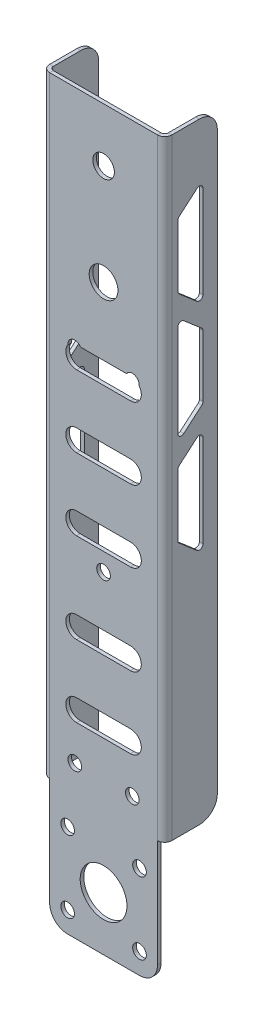
from build123d import *

# Parameters (mm, degrees)
SKETCH1_R                  = 6.5
SKETCH1_R_2                = 3
SKETCH1_R_3                = 4
BASE_FLANGE1_DEPTH         = 1
FILLET1_R                  = 5
SKETCHED_START             = 16.78876
SKETCHED_BEND1_OUTLINE_W   = 170
SKETCHED_BEND1_OUTLINE_H   = 1
SKETCHED_BEND1_DEPTH       = 13.21124
SKETCHED_START_2           = -30
SKETCHED_BEND1_2_OUTLINE_W = 170
SKETCHED_BEND1_2_OUTLINE_H = 1
SKETCHED_BEND1_2_DEPTH     = 13.18876
SKETCHED_START_3           = 16
SKETCHED_BEND1_3_DEPTH     = 0.0274
SKETCHED_START_4           = -16.01124
SKETCHED_BEND1_4_DEPTH     = 0.01124
SKETCHED_START_5           = -17
SKETCHED_BEND1_5_DEPTH     = 2
SKETCHED_START_6           = 15
SKETCHED_BEND1_6_DEPTH     = 2
SKETCHED_START_7           = -40.18
SKETCHED_BEND1_7_DEPTH     = 170
FILLET2_R                  = 1
F_6_CLEARANCE_HOLE2_D      = 3.7973
CUT_EXTRUDE1_DEPTH         = 10


with BuildPart() as part:
    # Base-Flange1: sheet metal written as solids
    # Sketch1 → Base-Flange1 (new body)
    with BuildSketch(Plane.XY):
        Polygon((-30, 129.82), (30, 129.82), (30, -40.18), (15, -40.18), (15, -75.18), (-15, -75.18), (-15, -40.18), (-30, -40.18), align=None)
        with Locations((0, -60.18)):
            Circle(SKETCH1_R, mode=Mode.SUBTRACT)
        with Locations((0, 114.82)):
            Circle(SKETCH1_R_2, mode=Mode.SUBTRACT)
        with Locations((0, 86.82)):
            Circle(SKETCH1_R_3, mode=Mode.SUBTRACT)
        Polygon((-26, 114.82), (-19, 108.82), (-19, 90.82), (-26, 84.82), align=None, mode=Mode.SUBTRACT)
        Polygon((-26, 78.82), (-19, 84.82), (-19, 54.82), (-26, 60.82), align=None, mode=Mode.SUBTRACT)
        Polygon((-26, 24.82), (-26, 54.82), (-19, 48.82), (-19, 30.82), align=None, mode=Mode.SUBTRACT)
        Polygon((19, 30.82), (26, 24.82), (26, 54.82), (19, 48.82), align=None, mode=Mode.SUBTRACT)
        Polygon((19, 54.82), (26, 60.82), (26, 78.82), (19, 84.82), align=None, mode=Mode.SUBTRACT)
        Polygon((19, 90.82), (26, 84.82), (26, 114.82), (19, 108.82), align=None, mode=Mode.SUBTRACT)
    extrude(amount=-BASE_FLANGE1_DEPTH)

    # Fillet1
    fillet1_edges = [part.edges().sort_by_distance(p)[0] for p in [
        (-30, 129.82, -0.5),
        (30, 129.82, -0.5),
        (30, -40.18, -0.5),
        (15, -75.18, -0.5),
        (-15, -75.18, -0.5),
        (-30, -40.18, -0.5),
    ]]
    fillet(fillet1_edges, radius=FILLET1_R)

    # Sketched Bend1: read off the stored shape, not the designer's step
    # Sketched Bend1 outline → Sketched Bend1 (cut)
    with BuildSketch(Plane.YZ.offset(SKETCHED_START)):
        with Locations((44.82, -0.5)):
            Rectangle(SKETCHED_BEND1_OUTLINE_W, SKETCHED_BEND1_OUTLINE_H)
    extrude(amount=SKETCHED_BEND1_DEPTH, mode=Mode.SUBTRACT)

    # Sketched Bend1 2 outline → Sketched Bend1 2 (cut)
    with BuildSketch(Plane.YZ.offset(SKETCHED_START_2)):
        with Locations((44.82, -0.5)):
            Rectangle(SKETCHED_BEND1_2_OUTLINE_W, SKETCHED_BEND1_2_OUTLINE_H)
    extrude(amount=SKETCHED_BEND1_2_DEPTH, mode=Mode.SUBTRACT)

    # Sketched Bend1 3 outline → Sketched Bend1 3 (add)
    with BuildSketch(Plane.YZ.offset(SKETCHED_START_3)):
        with BuildLine():
            Line((129.82, -9.64380551), (129.82, -1))
            Line((129.82, -1), (-40.18, -1))
            Line((-40.18, -1), (-40.18, -9.64380551))
            ThreePointArc((-40.18, -9.64380551), (-38.715533906, -13.179339416), (-35.18, -14.64380551))
            Line((-35.18, -14.64380551), (124.82, -14.64380551))
            ThreePointArc((124.82, -14.64380551), (128.355533906, -13.179339416), (129.82, -9.64380551))
        make_face()
        Polygon((30.82, -3.64380551), (48.82, -3.64380551), (54.82, -10.64380551), (24.82, -10.64380551), align=None, mode=Mode.SUBTRACT)
        Polygon((54.82, -3.64380551), (84.82, -3.64380551), (78.82, -10.64380551), (60.82, -10.64380551), align=None, mode=Mode.SUBTRACT)
        Polygon((90.82, -3.64380551), (108.82, -3.64380551), (114.82, -10.64380551), (84.82, -10.64380551), align=None, mode=Mode.SUBTRACT)
    extrude(amount=SKETCHED_BEND1_3_DEPTH)

    # Sketched Bend1 4 outline → Sketched Bend1 4 (add)
    with BuildSketch(Plane.YZ.offset(SKETCHED_START_4)):
        with BuildLine():
            Line((129.82, -9.64380551), (129.82, -1))
            Line((129.82, -1), (-40.18, -1))
            Line((-40.18, -1), (-40.18, -9.64380551))
            ThreePointArc((-40.18, -9.64380551), (-38.715533906, -13.179339416), (-35.18, -14.64380551))
            Line((-35.18, -14.64380551), (124.82, -14.64380551))
            ThreePointArc((124.82, -14.64380551), (128.355533906, -13.179339416), (129.82, -9.64380551))
        make_face()
        Polygon((30.82, -3.64380551), (48.82, -3.64380551), (54.82, -10.64380551), (24.82, -10.64380551), align=None, mode=Mode.SUBTRACT)
        Polygon((54.82, -3.64380551), (84.82, -3.64380551), (78.82, -10.64380551), (60.82, -10.64380551), align=None, mode=Mode.SUBTRACT)
        Polygon((90.82, -3.64380551), (108.82, -3.64380551), (114.82, -10.64380551), (84.82, -10.64380551), align=None, mode=Mode.SUBTRACT)
    extrude(amount=SKETCHED_BEND1_4_DEPTH)

    # Sketched Bend1 5 outline → Sketched Bend1 5 (add)
    with BuildSketch(Plane.YZ.offset(SKETCHED_START_5)):
        with BuildLine():
            Line((129.82, -9.64380551), (129.82, -1))
            Line((129.82, -1), (-40.18, -1))
            Line((-40.18, -1), (-40.18, -9.64380551))
            ThreePointArc((-40.18, -9.64380551), (-38.715533906, -13.179339416), (-35.18, -14.64380551))
            Line((-35.18, -14.64380551), (124.82, -14.64380551))
            ThreePointArc((124.82, -14.64380551), (128.355533906, -13.179339416), (129.82, -9.64380551))
        make_face()
        Polygon((30.82, -3.64380551), (48.82, -3.64380551), (54.82, -10.64380551), (24.82, -10.64380551), align=None, mode=Mode.SUBTRACT)
        Polygon((54.82, -3.64380551), (84.82, -3.64380551), (78.82, -10.64380551), (60.82, -10.64380551), align=None, mode=Mode.SUBTRACT)
        Polygon((90.82, -3.64380551), (108.82, -3.64380551), (114.82, -10.64380551), (84.82, -10.64380551), align=None, mode=Mode.SUBTRACT)
    extrude(amount=SKETCHED_BEND1_5_DEPTH)

    # Sketched Bend1 6 outline → Sketched Bend1 6 (add)
    with BuildSketch(Plane.YZ.offset(SKETCHED_START_6)):
        with BuildLine():
            Line((129.82, -9.64380551), (129.82, -1))
            Line((129.82, -1), (-40.18, -1))
            Line((-40.18, -1), (-40.18, -9.64380551))
            ThreePointArc((-40.18, -9.64380551), (-38.715533906, -13.179339416), (-35.18, -14.64380551))
            Line((-35.18, -14.64380551), (124.82, -14.64380551))
            ThreePointArc((124.82, -14.64380551), (128.355533906, -13.179339416), (129.82, -9.64380551))
        make_face()
        Polygon((30.82, -3.64380551), (48.82, -3.64380551), (54.82, -10.64380551), (24.82, -10.64380551), align=None, mode=Mode.SUBTRACT)
        Polygon((54.82, -3.64380551), (84.82, -3.64380551), (78.82, -10.64380551), (60.82, -10.64380551), align=None, mode=Mode.SUBTRACT)
        Polygon((90.82, -3.64380551), (108.82, -3.64380551), (114.82, -10.64380551), (84.82, -10.64380551), align=None, mode=Mode.SUBTRACT)
    extrude(amount=SKETCHED_BEND1_6_DEPTH)

    # Sketched Bend1 7 outline → Sketched Bend1 7 (cut)
    with BuildSketch(Plane(origin=(0, 0, 0), x_dir=(1, 0, 0), z_dir=(0, 1, 0)).offset(SKETCHED_START_7)):
        with BuildLine():
            ThreePointArc((-16, 2), (-15.707106781, 1.292893219), (-15, 1))
            Line((-15, 1), (-15, 14.64380551))
            Line((-15, 14.64380551), (-16, 14.64380551))
            Line((-16, 14.64380551), (-16, 2))
        make_face()
        with BuildLine():
            ThreePointArc((17, 2), (16.414213562, 0.585786438), (15, 0))
            Line((15, 0), (16.78876, 0))
            Line((16.78876, 0), (16.78876, 1))
            Line((16.78876, 1), (17, 1))
            Line((17, 1), (17, 2))
        make_face()
        with BuildLine():
            ThreePointArc((-15, 0), (-16.414213562, 0.585786438), (-17, 2))
            Line((-17, 2), (-17, 1))
            Line((-17, 1), (-16.81124, 1))
            Line((-16.81124, 1), (-16.81124, 0))
            Line((-16.81124, 0), (-15, 0))
        make_face()
        with BuildLine():
            ThreePointArc((15, 1), (15.707106781, 1.292893219), (16, 2))
            Line((16, 2), (16, 14.64380551))
            Line((16, 14.64380551), (15, 14.64380551))
            Line((15, 14.64380551), (15, 1))
        make_face()
    extrude(amount=SKETCHED_BEND1_7_DEPTH, mode=Mode.SUBTRACT)

    # Fillet2
    fillet2_edges = [part.edges().sort_by_distance(p)[0] for p in [
        (-16.5, 90.82, -3.64380551),
        (-16.5, 84.82, -10.64380551),
        (-16.5, 114.82, -10.64380551),
        (-16.5, 108.82, -3.64380551),
        (-16.5, 84.82, -3.64380551),
        (-16.5, 54.82, -3.64380551),
        (-16.5, 60.82, -10.64380551),
        (-16.5, 78.82, -10.64380551),
        (-16.5, 24.82, -10.64380551),
        (-16.5, 54.82, -10.64380551),
        (-16.5, 48.82, -3.64380551),
        (-16.5, 30.82, -3.64380551),
        (16.5, 24.82, -10.64380551),
        (16.5, 30.82, -3.64380551),
        (16.5, 48.82, -3.64380551),
        (16.5, 54.82, -10.64380551),
        (16.5, 60.82, -10.64380551),
        (16.5, 54.82, -3.64380551),
        (16.5, 84.82, -3.64380551),
        (16.5, 78.82, -10.64380551),
        (16.5, 84.82, -10.64380551),
        (16.5, 90.82, -3.64380551),
        (16.5, 108.82, -3.64380551),
        (16.5, 114.82, -10.64380551),
    ]]
    fillet(fillet2_edges, radius=FILLET2_R)

    # #6 Clearance Hole2 (through all)
    with Locations(Plane.XY):
        with Locations((-8, 67), (8, 67), (0, 17), (-8, -33), (8, -33), (-10, -49.375603427), (10, -49.375603427), (-10, -69.375603427), (10, -69.375603427), (28.213155681, -64.18604224)):
            Hole(F_6_CLEARANCE_HOLE2_D / 2)

    # Sketch13 → Cut-Extrude1 (cut)
    with BuildSketch(Plane.XY):
        with BuildLine():
            Line((-7.5, 3), (7.5, 3))
            ThreePointArc((7.5, 3), (10.5, 0), (7.5, -3))
            Line((7.5, -3), (-7.5, -3))
            ThreePointArc((-7.5, -3), (-10.5, 0), (-7.5, 3))
        make_face()
        with BuildLine():
            Line((-7.5, -17), (7.5, -17))
            ThreePointArc((7.5, -17), (10.5, -20), (7.5, -23))
            Line((7.5, -23), (-7.5, -23))
            ThreePointArc((-7.5, -23), (-10.5, -20), (-7.5, -17))
        make_face()
        with BuildLine():
            Line((-7.5, 28), (7.5, 28))
            ThreePointArc((7.5, 28), (10.5, 25), (7.5, 22))
            Line((7.5, 22), (-7.5, 22))
            ThreePointArc((-7.5, 22), (-10.5, 25), (-7.5, 28))
        make_face()
        with BuildLine():
            Line((-7.5, 48), (7.5, 48))
            ThreePointArc((7.5, 48), (10.5, 45), (7.5, 42))
            Line((7.5, 42), (-7.5, 42))
            ThreePointArc((-7.5, 42), (-10.5, 45), (-7.5, 48))
        make_face()
        with BuildLine():
            Line((-7.5, 68), (7.5, 68))
            ThreePointArc((7.5, 68), (10.5, 65), (7.5, 62))
            Line((7.5, 62), (-7.5, 62))
            ThreePointArc((-7.5, 62), (-10.5, 65), (-7.5, 68))
        make_face()
    extrude(amount=-CUT_EXTRUDE1_DEPTH, mode=Mode.SUBTRACT)


solid = part.part
